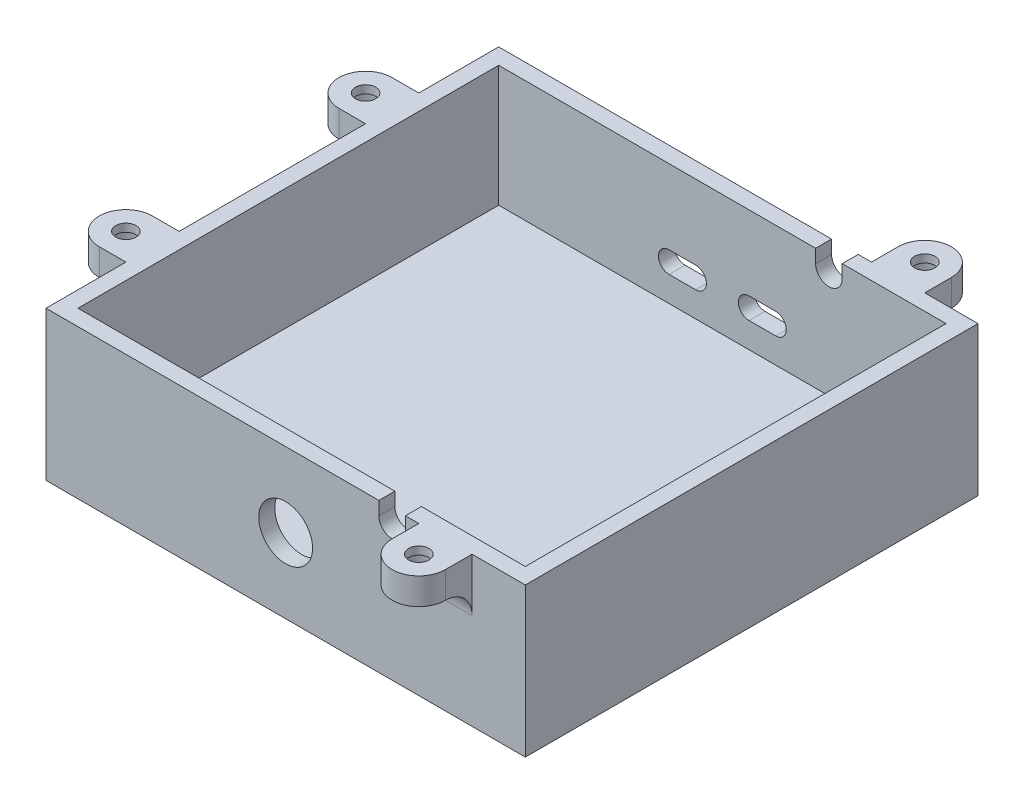
from build123d import *

# Parameters (mm, degrees)
SKETCH1_W                                      = 90
SKETCH1_H                                      = 85
BOSS_EXTRUDE1_DEPTH                            = 28
SHELL1_T                                       = -3
SHELL1_THICKNESS_2_FACE_W                      = 79
SHELL1_THICKNESS_2_FACE_H                      = 84
SHELL1_THICKNESS_2_DEPTH                       = 2.25
CUT_EXTRUDE1_REACH                             = 102.17
SKETCH2_R                                      = 5.05
BOSS_EXTRUDE2_DEPTH                            = 5
BOSS_EXTRUDE3_DEPTH                            = 5
CBORE_FOR_6_SOCKET_HEAD_CAP_SCREW1_D           = 3.7973
CBORE_FOR_6_SOCKET_HEAD_CAP_SCREW1_CBORE_D     = 7.62
CBORE_FOR_6_SOCKET_HEAD_CAP_SCREW1_CBORE_DEPTH = 3.5052
FILLET1_R                                      = 5
CUT_EXTRUDE2_DEPTH                             = 114.287245531
CUT_EXTRUDE4_REACH                             = 124.741


with BuildPart() as part:
    # Sketch1 → Boss-Extrude1 (new body)
    with BuildSketch(Plane(origin=(0, 0, 0), x_dir=(1, 0, 0), z_dir=(0, 1, 0))):
        Rectangle(SKETCH1_W, SKETCH1_H)
    extrude(amount=BOSS_EXTRUDE1_DEPTH)

    # Shell1
    shell1_openings = [part.faces().sort_by_distance(p)[0] for p in [
        (0, 28, 0),
    ]]
    offset(amount=SHELL1_T, openings=shell1_openings, kind=Kind.INTERSECTION)

    # Shell1 thickness 2 face (on inner face of the shell) → Shell1 thickness 2 (add)
    with BuildSketch(Plane(origin=(0, 3, 0), x_dir=(0, 0, -1), z_dir=(0, -1, 0))):
        Rectangle(SHELL1_THICKNESS_2_FACE_W, SHELL1_THICKNESS_2_FACE_H)
    extrude(amount=-SHELL1_THICKNESS_2_DEPTH)

    # Sketch2 → Cut-Extrude1 (cut, up to next)
    with BuildSketch(Plane.XY.offset(42.5), mode=Mode.PRIVATE) as cut_extrude1_sk1:
        with Locations((0, 14)):
            Circle(SKETCH2_R)
    cut_extrude1_tool1 = extrude(cut_extrude1_sk1.sketch, amount=-CUT_EXTRUDE1_REACH, mode=Mode.PRIVATE) & part.part
    add(cut_extrude1_tool1.solids().sort_by_distance((0, 14, 42.5))[0], mode=Mode.SUBTRACT)

    # Sketch3 → Boss-Extrude2 (add)
    with BuildSketch(Plane(origin=(0, 28, 0), x_dir=(1, 0, 0), z_dir=(0, 1, 0))):
        with BuildLine():
            Line((-50, 27.5), (-45, 27.5))
            Line((-45, 27.5), (-45, 17.5))
            Line((-45, 17.5), (-50, 17.5))
            ThreePointArc((-50, 17.5), (-55, 22.5), (-50, 27.5))
        make_face()
    boss_extrude2 = extrude(amount=-BOSS_EXTRUDE2_DEPTH)

    # Mirror1: Boss-Extrude2 across plane
    add(boss_extrude2.mirror(Plane.XY))

    # Sketch4 → Boss-Extrude3 (add)
    with BuildSketch(Plane(origin=(0, 28, 0), x_dir=(1, 0, 0), z_dir=(0, 1, 0))):
        with BuildLine():
            Line((25, 47.5), (25, 42.5))
            Line((25, 42.5), (35, 42.5))
            Line((35, 42.5), (35, 47.5))
            ThreePointArc((35, 47.5), (30, 52.5), (25, 47.5))
        make_face()
    boss_extrude3 = extrude(amount=-BOSS_EXTRUDE3_DEPTH)

    # Mirror2: Boss-Extrude3 across plane
    add(boss_extrude3.mirror(Plane.XY))

    # CBORE for #6 Socket Head Cap Screw1 (through all)
    with Locations(Plane(origin=(0, 23, 0), x_dir=(-1, 0, 0), z_dir=(0, -1, 0))):
        with Locations((-30, 47.5), (-30, -47.5), (50, -22.5), (50, 22.5)):
            CounterBoreHole(CBORE_FOR_6_SOCKET_HEAD_CAP_SCREW1_D / 2, CBORE_FOR_6_SOCKET_HEAD_CAP_SCREW1_CBORE_D / 2, CBORE_FOR_6_SOCKET_HEAD_CAP_SCREW1_CBORE_DEPTH)

    # Fillet1
    # the kernel refuses this fillet: 5 mm, written as the material it adds along each edge
    with BuildSketch(Plane(origin=(25, 23, -42.5), x_dir=(0, -1, 0), z_dir=(1, 0, 0))) as fillet1_piece_1_section:
        with BuildLine():
            CenterArc((FILLET1_R, FILLET1_R), FILLET1_R, 180, 90)
            Line((0, FILLET1_R), (0, 0))
            Line((0, 0), (FILLET1_R, 0))
        make_face()
    fillet1_piece_1 = extrude(amount=10, mode=Mode.PRIVATE)
    fillet1_piece_1 = fillet1_piece_1 - Plane(origin=(30, 21.803509944, -47.5), x_dir=(-1, 0, 0), z_dir=(0, -1, 0)) * Cylinder(3.81, 40, mode=Mode.PRIVATE)
    add(fillet1_piece_1)
    with BuildSketch(Plane(origin=(25, 23, 42.5), x_dir=(0, -1, 0), z_dir=(1, 0, 0))) as fillet1_piece_2_section:
        with BuildLine():
            CenterArc((FILLET1_R, -FILLET1_R), FILLET1_R, 90, 90)
            Line((0, -FILLET1_R), (0, 0))
            Line((0, 0), (FILLET1_R, 0))
        make_face()
    fillet1_piece_2 = extrude(amount=10, mode=Mode.PRIVATE)
    fillet1_piece_2 = fillet1_piece_2 - Plane(origin=(30, 21.803509344, 47.5), x_dir=(-1, 0, 0), z_dir=(0, -1, 0)) * Cylinder(3.81, 40, mode=Mode.PRIVATE)
    add(fillet1_piece_2)
    with BuildSketch(Plane(origin=(-45, 23, -27.5), x_dir=(0, -1, 0), z_dir=(0, 0, 1))) as fillet1_piece_3_section:
        with BuildLine():
            CenterArc((FILLET1_R, -FILLET1_R), FILLET1_R, 90, 90)
            Line((0, -FILLET1_R), (0, 0))
            Line((0, 0), (FILLET1_R, 0))
        make_face()
    fillet1_piece_3 = extrude(amount=10, mode=Mode.PRIVATE)
    fillet1_piece_3 = fillet1_piece_3 - Plane(origin=(-50, 21.803509344, -22.5), x_dir=(-1, 0, 0), z_dir=(0, -1, 0)) * Cylinder(3.81, 40, mode=Mode.PRIVATE)
    add(fillet1_piece_3)
    with BuildSketch(Plane(origin=(-45, 23, 27.5), x_dir=(0, -1, 0), z_dir=(0, 0, -1))) as fillet1_piece_4_section:
        with BuildLine():
            CenterArc((FILLET1_R, FILLET1_R), FILLET1_R, 180, 90)
            Line((0, FILLET1_R), (0, 0))
            Line((0, 0), (FILLET1_R, 0))
        make_face()
    fillet1_piece_4 = extrude(amount=10, mode=Mode.PRIVATE)
    fillet1_piece_4 = fillet1_piece_4 - Plane(origin=(-50, 21.803509944, 22.5), x_dir=(-1, 0, 0), z_dir=(0, -1, 0)) * Cylinder(3.81, 40, mode=Mode.PRIVATE)
    add(fillet1_piece_4)

    # Sketch9 → Cut-Extrude2 (cut, through all)
    with BuildSketch(Plane.XY.offset(42.5)):
        with BuildLine():
            Line((22.5, 28), (22.5, 25.5))
            ThreePointArc((22.5, 25.5), (20, 23), (17.5, 25.5))
            Line((17.5, 25.5), (17.5, 28))
            ThreePointArc((17.5, 28), (20, 30.5), (22.5, 28))
        make_face()
    extrude(amount=-CUT_EXTRUDE2_DEPTH, mode=Mode.SUBTRACT)

    # Sketch10 → Cut-Extrude4 (cut, up to next)
    with BuildSketch(Plane(origin=(17.5, 0, -42.5), x_dir=(1, 0, 0), z_dir=(0, 0, 1)), mode=Mode.PRIVATE) as cut_extrude4_sk1:
        with BuildLine():
            Line((-27.5, 14), (-22.5, 14))
            ThreePointArc((-22.5, 14), (-20.5, 12), (-22.5, 10))
            Line((-22.5, 10), (-27.5, 10))
            ThreePointArc((-27.5, 10), (-29.5, 12), (-27.5, 14))
        make_face()
    cut_extrude4_tool1 = extrude(cut_extrude4_sk1.sketch, amount=CUT_EXTRUDE4_REACH, mode=Mode.PRIVATE) & part.part
    # Sketch10 → Cut-Extrude4 (cut, up to next)
    with BuildSketch(Plane(origin=(17.5, 0, -42.5), x_dir=(1, 0, 0), z_dir=(0, 0, 1)), mode=Mode.PRIVATE) as cut_extrude4_sk2:
        with BuildLine():
            Line((-7.5, 14), (-12.5, 14))
            ThreePointArc((-12.5, 14), (-14.5, 12), (-12.5, 10))
            Line((-12.5, 10), (-7.5, 10))
            ThreePointArc((-7.5, 10), (-5.5, 12), (-7.5, 14))
        make_face()
    cut_extrude4_tool2 = extrude(cut_extrude4_sk2.sketch, amount=CUT_EXTRUDE4_REACH, mode=Mode.PRIVATE) & part.part
    add(cut_extrude4_tool1.solids().sort_by_distance((-7.5, 12, -42.5))[0], mode=Mode.SUBTRACT)
    add(cut_extrude4_tool2.solids().sort_by_distance((7.5, 12, -42.5))[0], mode=Mode.SUBTRACT)


solid = part.part
